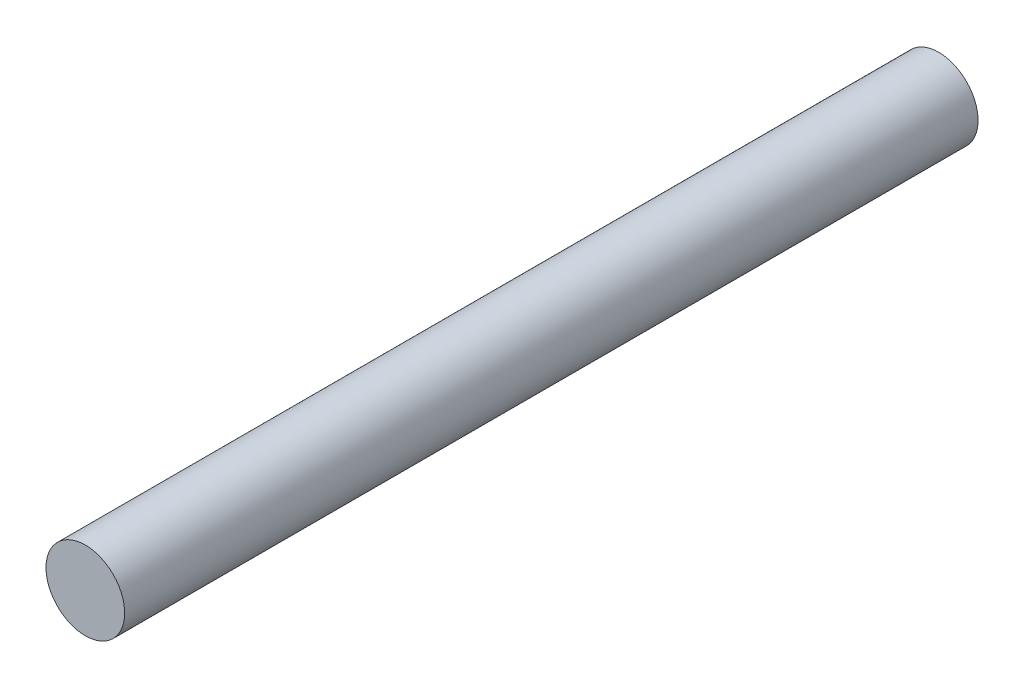
from build123d import *

# Parameters (mm, degrees)
CROQUIS1_R              = 2.475
SALIENTE_EXTRUIR1_DEPTH = 53.7


with BuildPart() as part:
    # Croquis1 → Saliente-Extruir1 (new body)
    with BuildSketch(Plane.XY):
        Circle(CROQUIS1_R)
    extrude(amount=SALIENTE_EXTRUIR1_DEPTH)


solid = part.part
